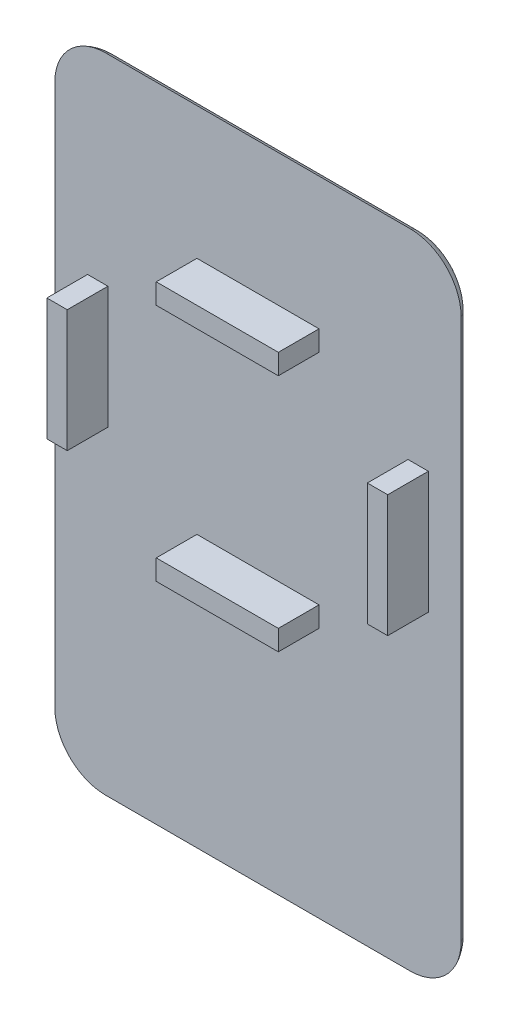
from build123d import *

# Parameters (mm, degrees)
SKETCH_1_W      = 39.94
SKETCH_1_H      = 63.19
EXTRUDE_1_DEPTH = 1.2
FILLET_1_R      = 5
FILLET_3_R      = 2
SKETCH_5_W      = 2
SKETCH_5_H      = 12
SKETCH_5_W_2    = 12
SKETCH_5_H_2    = 2
EXTRUDE_4_DEPTH = 4


with BuildPart() as part:
    # 草图1 → 凸台-拉伸1 (new body)
    with BuildSketch(Plane.XY):
        Rectangle(SKETCH_1_W, SKETCH_1_H)
    extrude(amount=EXTRUDE_1_DEPTH)

    # 圆角1
    fillet_1_edges = [part.edges().sort_by_distance(p)[0] for p in [
        (19.97, -31.595, 0.6),
        (-19.97, -31.595, 0.6),
        (-19.97, 31.595, 0.6),
        (19.97, 31.595, 0.6),
    ]]
    fillet(fillet_1_edges, radius=FILLET_1_R)

    # 圆角3
    # the kernel refuses this fillet: 2 mm, written as the material it takes off along each edge
    with BuildSketch(Plane(origin=(-14.97, -26.595, 0), x_dir=(0, -1, 0), z_dir=(1, 0, 0))) as fillet_3_piece_1:
        with BuildLine():
            CenterArc((3.166969722, -2), FILLET_3_R, 23.578178478, 66.421821522)
            Line((5, -1.2), (5.036660606, -1.184))
            ThreePointArc((5.036660606, -1.184), (5.04, -0.6), (5.04, 0))
            Line((5.04, 0), (5, 0.04))
            Line((5, 0.04), (3.166969722, 0.04))
            Line((3.166969722, 0.04), (3.166969722, 0))
        make_face()
    revolve(axis=Axis((-14.97, -26.595, 0), (0, 0, -1)), revolution_arc=90, mode=Mode.SUBTRACT)
    with BuildSketch(Plane(origin=(14.97, -31.595, 0), x_dir=(0, 1, 0), z_dir=(-1, 0, 0))) as fillet_3_piece_2:
        with BuildLine():
            CenterArc((1.833030278, -2), FILLET_3_R, 90, 66.421821522)
            Line((0, -1.2), (-0.036660606, -1.184))
            ThreePointArc((-0.036660606, -1.184), (-0.04, -0.6), (-0.04, 0))
            Line((-0.04, 0), (0, 0.04))
            Line((0, 0.04), (1.833030278, 0.04))
            Line((1.833030278, 0.04), (1.833030278, 0))
        make_face()
    extrude(amount=29.94, mode=Mode.SUBTRACT)
    with BuildSketch(Plane(origin=(14.97, -26.595, 0), x_dir=(1, 0, 0), z_dir=(0, 1, 0))) as fillet_3_piece_3:
        with BuildLine():
            CenterArc((3.166969722, -2), FILLET_3_R, 23.578178478, 66.421821522)
            Line((5, -1.2), (5.036660606, -1.184))
            ThreePointArc((5.036660606, -1.184), (5.04, -0.6), (5.04, 0))
            Line((5.04, 0), (5, 0.04))
            Line((5, 0.04), (3.166969722, 0.04))
            Line((3.166969722, 0.04), (3.166969722, 0))
        make_face()
    revolve(axis=Axis((14.97, -26.595, 0), (0, 0, -1)), revolution_arc=90, mode=Mode.SUBTRACT)
    with BuildSketch(Plane(origin=(19.97, 26.595, 0), x_dir=(-1, 0, 0), z_dir=(0, -1, 0)), Plane(origin=(-19.97, -26.595, 0), x_dir=(1, 0, 0), z_dir=(0, 1, 0))) as fillet_3_piece_4:
        with BuildLine():
            CenterArc((1.833030278, -2), FILLET_3_R, 90, 66.421821522)
            Line((0, -1.2), (-0.036660606, -1.184))
            ThreePointArc((-0.036660606, -1.184), (-0.04, -0.6), (-0.04, 0))
            Line((-0.04, 0), (0, 0.04))
            Line((0, 0.04), (1.833030278, 0.04))
            Line((1.833030278, 0.04), (1.833030278, 0))
        make_face()
    extrude(amount=53.19, mode=Mode.SUBTRACT)
    with BuildSketch(Plane(origin=(14.97, 26.595, 0), x_dir=(0, 1, 0), z_dir=(-1, 0, 0))) as fillet_3_piece_5:
        with BuildLine():
            CenterArc((3.166969722, -2), FILLET_3_R, 23.578178478, 66.421821522)
            Line((5, -1.2), (5.036660606, -1.184))
            ThreePointArc((5.036660606, -1.184), (5.04, -0.6), (5.04, 0))
            Line((5.04, 0), (5, 0.04))
            Line((5, 0.04), (3.166969722, 0.04))
            Line((3.166969722, 0.04), (3.166969722, 0))
        make_face()
    revolve(axis=Axis((14.97, 26.595, 0), (0, 0, -1)), revolution_arc=90, mode=Mode.SUBTRACT)
    with BuildSketch(Plane(origin=(-14.97, 31.595, 0), x_dir=(0, 0, 1), z_dir=(1, 0, 0))) as fillet_3_piece_6:
        with BuildLine():
            CenterArc((2, 1.833030278), FILLET_3_R, 180, 66.421821522)
            Line((0, 1.833030278), (-0.04, 1.833030278))
            Line((-0.04, 1.833030278), (-0.04, 0))
            Line((-0.04, 0), (0, -0.04))
            ThreePointArc((0, -0.04), (0.6, -0.04), (1.184, -0.036660606))
            Line((1.184, -0.036660606), (1.2, 0))
        make_face()
    extrude(amount=29.94, mode=Mode.SUBTRACT)
    with BuildSketch(Plane(origin=(-14.97, 26.595, 0), x_dir=(0, 1, 0), z_dir=(1, 0, 0))) as fillet_3_piece_7:
        with BuildLine():
            CenterArc((3.166969722, 2), FILLET_3_R, 270, 66.421821522)
            Line((5, 1.2), (5.036660606, 1.184))
            ThreePointArc((5.036660606, 1.184), (5.04, 0.6), (5.04, 0))
            Line((5.04, 0), (5, -0.04))
            Line((5, -0.04), (3.166969722, -0.04))
            Line((3.166969722, -0.04), (3.166969722, 0))
        make_face()
    revolve(axis=Axis((-14.97, 26.595, 0), (0, 0, 1)), revolution_arc=90, mode=Mode.SUBTRACT)

    # 草图5 → 凸台-拉伸4 (add)
    with BuildSketch(Plane.XY.offset(1.2)):
        with Locations((-15.75, 5.845)):
            Rectangle(SKETCH_5_W, SKETCH_5_H)
        with Locations((0, 17.595)):
            Rectangle(SKETCH_5_W_2, SKETCH_5_H_2)
        with Locations((0, -5.905)):
            Rectangle(SKETCH_5_W_2, SKETCH_5_H_2)
        with Locations((15.75, 5.845)):
            Rectangle(SKETCH_5_W, SKETCH_5_H)
    extrude(amount=EXTRUDE_4_DEPTH)


solid = part.part
